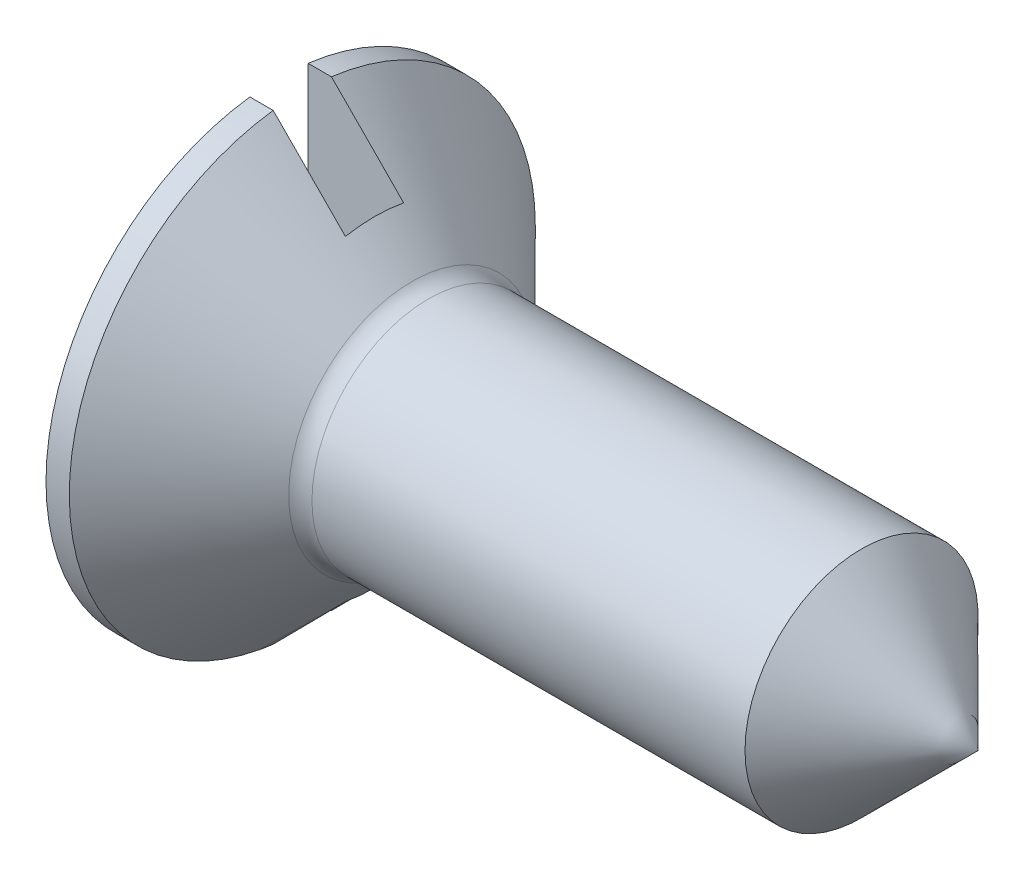
from build123d import *

# Parameters (mm, degrees)
SKETCH1_R          = 1
BASEBODY_DEPTH     = 4.8
SKETCH3_R          = 2.2
SKETCH3_R_2        = 2
CUT_EXTRUDE1_DEPTH = 8.445077189
SLOT_DEPTH         = 7.05673892
SLOT_DEPTH_BACK    = 7.05673892
SKETCH4_W          = 0.5
SKETCH4_H          = 0.82
FILLET1_R          = 0.2


with BuildPart() as part:
    # Sketch2 → BaseHead (revolve)
    with BuildSketch(Plane(origin=(1.60933929, 0, 0.59066071), x_dir=(0, 0, -1), z_dir=(0, 1, 0))):
        Polygon((1.59066071, 0.40933929), (2.79066071, 1.60933929), (0.59066071, 1.60933929), (0.59066071, 0.40933929), align=None)
    revolve(axis=Axis((6, 0, 0), (-1, 0, 0)))

    # Sketch1 → BaseBody (add)
    with BuildSketch(Plane(origin=(1.2, -0.034835154, 0.056110568), x_dir=(0, 0, -1), z_dir=(1, 0, 0))):
        with Locations((0.056110568, 0.034835154)):
            Circle(SKETCH1_R)
    extrude(amount=BASEBODY_DEPTH)

    # Sketch3 → Cut-Extrude1 (cut, through all)
    with BuildSketch(Plane(origin=(0, -1.05900049, 0.767842678), x_dir=(0, 0, 1), z_dir=(-1, 0, 0))):
        with Locations((-0.767842678, 1.05900049)):
            Circle(SKETCH3_R)
        with Locations((-0.767842678, 1.05900049)):
            Circle(SKETCH3_R_2, mode=Mode.SUBTRACT)
    extrude(amount=-CUT_EXTRUDE1_DEPTH, mode=Mode.SUBTRACT)

    # Sketch4 → Slot (cut, two sides: drawn at the far end of the back side and taken through both)
    with BuildSketch(Plane(origin=(1.415155428, 0, -1.415155428), x_dir=(0, 0, -1), z_dir=(0, 1, 0)).offset(-SLOT_DEPTH_BACK)):
        with Locations((-1.415155428, 1.005155428)):
            Rectangle(SKETCH4_W, SKETCH4_H)
    extrude(amount=SLOT_DEPTH + SLOT_DEPTH_BACK, mode=Mode.SUBTRACT)

    # Sketch5 → Cut-Revolve1 (revolve, cut)
    with BuildSketch(Plane(origin=(23.669440459, -6.330559541, 0), x_dir=(0, 1, 0), z_dir=(0, 0, 1))):
        Polygon((6.330559541, 17.323959828), (36.330559541, 17.323959828), (36.330559541, 47.669440459), (6.330559541, 17.669440459), align=None)
    revolve(axis=Axis((30.330559541, 0, 0), (-1, 0, 0)), mode=Mode.SUBTRACT)

    # Fillet1
    fillet1_edges = [part.edges().sort_by_distance(p)[0] for p in [
        (1.2, 0, 1),
    ]]
    fillet(fillet1_edges, radius=FILLET1_R)


solid = part.part
